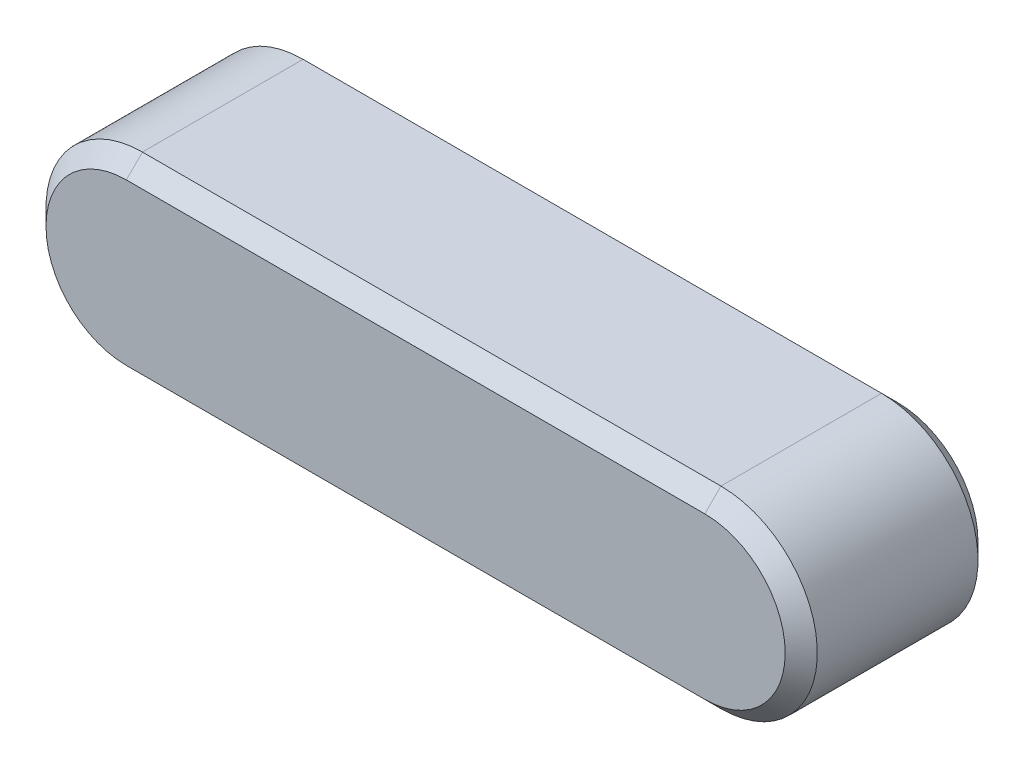
from build123d import *

# Parameters (mm, degrees)
BOSS_EXTRU_1_DEPTH = 6
CHANFREIN1_SIZE    = 0.5


with BuildPart() as part:
    # Esquisse1 → Boss.-Extru.1 (new body)
    with BuildSketch(Plane.XY):
        with BuildLine():
            Line((-287.461782962, 423.327731578), (-305.461782962, 423.327731578))
            ThreePointArc((-305.461782962, 423.327731578), (-308.461782962, 426.327731578), (-305.461782962, 429.327731578))
            Line((-305.461782962, 429.327731578), (-287.461782962, 429.327731578))
            ThreePointArc((-287.461782962, 429.327731578), (-284.461782962, 426.327731578), (-287.461782962, 423.327731578))
        make_face()
    extrude(amount=BOSS_EXTRU_1_DEPTH)

    # Chanfrein1
    chanfrein1_edges = [part.edges().sort_by_distance(p)[0] for p in [
        (-284.461782962, 426.327731578, 6),
        (-296.461782962, 429.327731578, 6),
        (-296.461782962, 423.327731578, 6),
        (-308.461782962, 426.327731578, 6),
        (-284.461782962, 426.327731578, 0),
        (-296.461782962, 429.327731578, 0),
        (-296.461782962, 423.327731578, 0),
        (-308.461782962, 426.327731578, 0),
    ]]
    chamfer(chanfrein1_edges, length=CHANFREIN1_SIZE)


solid = part.part
